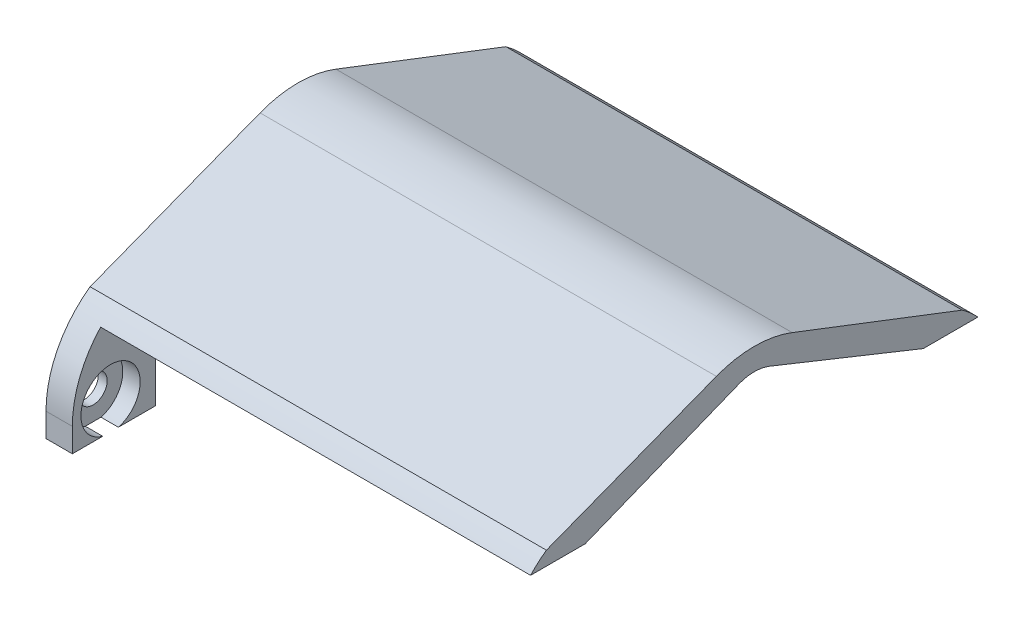
from build123d import *

# Parameters (mm, degrees)
BOSS_EXTRUDE1_DEPTH                                  = 110
FILLET1_R                                            = 25.4
FILLET2_R                                            = 10
SKETCH2_W                                            = 20
SKETCH2_H                                            = 23.04885876
CUT_EXTRUDE1_DEPTH                                   = 103.65
CBORE_FOR_1_4_BINDING_HEAD_MACHINE_SCREW_D           = 6.7564
CBORE_FOR_1_4_BINDING_HEAD_MACHINE_SCREW_CBORE_D     = 14.2875
CBORE_FOR_1_4_BINDING_HEAD_MACHINE_SCREW_CBORE_DEPTH = 4.191


with BuildPart() as part:
    # Sketch1 → Boss-Extrude1 (new body)
    with BuildSketch(Plane(origin=(0, 0, 0), x_dir=(0, 0, -1), z_dir=(1, 0, 0))):
        Polygon((0, 0), (20, 0), (20, 23.04885876), (60.747951032, 39.36618781), (101.495902064, 23.04885876), (101.495902064, 0), (121.495902064, 0), (121.495902064, 26.395679347), (110.865902064, 26.395679347), (60.747951032, 45.71618781), (10.63, 26.395679347), (0, 26.395679347), align=None)
    extrude(amount=BOSS_EXTRUDE1_DEPTH)

    # Fillet1
    # the kernel refuses this fillet: 25.4 mm, written as the material it takes off along each edge
    with BuildSketch(Plane(origin=(-51.660375289, 26.395679347, -121.495902064), x_dir=(0, -1, 0), z_dir=(1, 0, 0))) as fillet1_piece_1:
        with BuildLine():
            CenterArc((20.664150116, -25.4), FILLET1_R, 90, 54.444163321)
            Line((0, -10.63), (-0.413283002, -10.3346))
            ThreePointArc((-0.413283002, -10.3346), (-0.508, -5.315), (-0.508, 0))
            Line((-0.508, 0), (0, 0.508))
            Line((0, 0.508), (20.664150116, 0.508))
            Line((20.664150116, 0.508), (20.664150116, 0))
        make_face()
    extrude(amount=213.320750578, mode=Mode.SUBTRACT)
    with BuildSketch(Plane(origin=(-51.660375289, 26.395679347, 0), x_dir=(0, 0, -1), z_dir=(1, 0, 0))) as fillet1_piece_2:
        with BuildLine():
            CenterArc((25.4, -20.664150116), FILLET1_R, 125.555836679, 54.444163321)
            Line((0, -20.664150116), (-0.508, -20.664150116))
            Line((-0.508, -20.664150116), (-0.508, 0))
            Line((-0.508, 0), (0, 0.508))
            ThreePointArc((0, 0.508), (5.315, 0.508), (10.3346, 0.413283002))
            Line((10.3346, 0.413283002), (10.63, 0))
        make_face()
    extrude(amount=213.320750578, mode=Mode.SUBTRACT)
    with BuildSketch(Plane(origin=(-24.479298578, 45.71618781, -60.747951032), x_dir=(0, -0.35969863434758087, -0.9330685357724187), z_dir=(1, 0, 0))) as fillet1_piece_3:
        with BuildLine():
            CenterArc((FILLET1_R * 0.385500765011, -FILLET1_R), FILLET1_R, 90, 42.163378571)
            Line((-FILLET1_R * 0.285746191129, -FILLET1_R * 0.258766215103), (-FILLET1_R * 0.299171130252, -FILLET1_R * 0.243941539405))
            Line((-FILLET1_R * 0.299171130252, -FILLET1_R * 0.243941539405), (-FILLET1_R * 0.00771001530021, FILLET1_R * 0.02))
            Line((-FILLET1_R * 0.00771001530021, FILLET1_R * 0.02), (FILLET1_R * 0.385500765011, FILLET1_R * 0.02))
            Line((FILLET1_R * 0.385500765011, FILLET1_R * 0.02), (FILLET1_R * 0.385500765011, 0))
        make_face()
    extrude(amount=158.958597156, mode=Mode.SUBTRACT)

    # Fillet2
    fillet2_edges = [part.edges().sort_by_distance(p)[0] for p in [
        (55, 39.36618781, -60.747951032),
    ]]
    fillet(fillet2_edges, radius=FILLET2_R)

    # Sketch2 → Cut-Extrude1 (cut)
    with BuildSketch(Plane(origin=(110, 0, 0), x_dir=(0, 0, -1), z_dir=(1, 0, 0))):
        with Locations((10, 11.52442938)):
            Rectangle(SKETCH2_W, SKETCH2_H)
        with Locations((111.495902064, 11.52442938)):
            Rectangle(SKETCH2_W, SKETCH2_H)
    extrude(amount=-CUT_EXTRUDE1_DEPTH, mode=Mode.SUBTRACT)

    # CBORE for 1/4 Binding Head Machine Screw1 (through all)
    with Locations(Plane(origin=(6.35, 0, 0), x_dir=(0, 0, -1), z_dir=(1, 0, 0))):
        with Locations((9.21, 6.89), (112.285902064, 6.89)):
            CounterBoreHole(CBORE_FOR_1_4_BINDING_HEAD_MACHINE_SCREW_D / 2, CBORE_FOR_1_4_BINDING_HEAD_MACHINE_SCREW_CBORE_D / 2, CBORE_FOR_1_4_BINDING_HEAD_MACHINE_SCREW_CBORE_DEPTH)


solid = part.part
